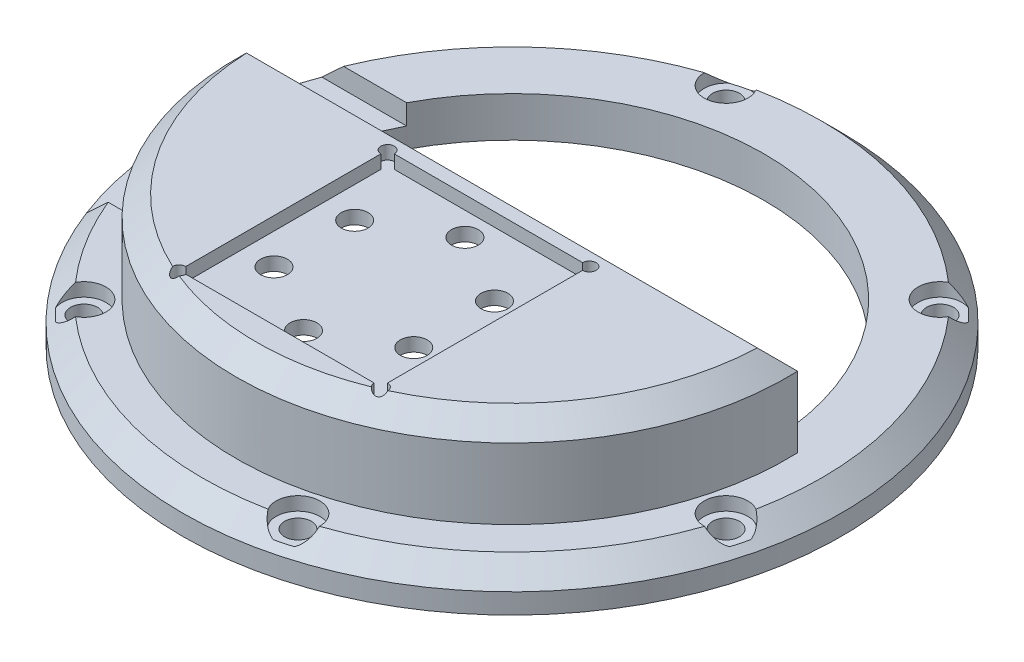
from build123d import *

# Parameters (mm, degrees)
SKETCH_1_R           = 49
SKETCH_1_R_2         = 37.5
SKETCH_1_R_3         = 2
EXTRUDE_1_DEPTH      = 15.5
EXTRUDE_START        = 15.5
SKETCH_1_3_R         = 49
SKETCH_1_3_R_2       = 2
EXTRUDE_2_DEPTH      = 4
CUT_EXTRUDE_START    = -8
SKETCH_2_W           = 31.667504192
SKETCH_2_H           = 35
CUT_EXTRUDE_1_DEPTH  = 8.5
SKETCH_4_R           = 3.25
CUT_EXTRUDE_3_DEPTH  = 15.5
CUT_EXTRUDE_START_2  = -13.5
SKETCH_6_R           = 49
SKETCH_6_R_2         = 41
CUT_EXTRUDE_7_DEPTH  = 13.5
SKETCH_8_R           = 2
CUT_EXTRUDE_9_DEPTH  = 16.5
SKETCH_7_W           = 30
SKETCH_7_H           = 31
CUT_EXTRUDE_11_DEPTH = 2
SKETCH_10_R          = 1
CUT_EXTRUDE_13_DEPTH = 2
SKETCH_12_W          = 94.768438907
SKETCH_12_H          = 47.5
CUT_EXTRUDE_14_DEPTH = 13.5
CHAMFER_1_SIZE       = 3
CHAMFER_2_SIZE       = 3
CHAMFER_3_SIZE       = 3


with BuildPart() as part:
    # 스케치1 → 보스-돌출1 (new body)
    with BuildSketch(Plane(origin=(0, 0, 0), x_dir=(1, 0, 0), z_dir=(0, 1, 0))):
        with Locations(Location((0, 0, 0), (0, 0, 270))):
            Circle(SKETCH_1_R)
        with Locations(Location((0, 0, 0), (0, 0, 270))):
            Circle(SKETCH_1_R_2, mode=Mode.SUBTRACT)
        with Locations(Location((-43.466662183, 11.64685703, 0), (0, 0, 270))):
            Circle(SKETCH_1_R_3, mode=Mode.SUBTRACT)
        with Locations(Location((-11.64685703, 43.466662183, 0), (0, 0, 270))):
            Circle(SKETCH_1_R_3, mode=Mode.SUBTRACT)
        with Locations(Location((31.819805153, 31.819805153, 0), (0, 0, 270))):
            Circle(SKETCH_1_R_3, mode=Mode.SUBTRACT)
        with Locations(Location((43.466662183, -11.64685703, 0), (0, 0, 270))):
            Circle(SKETCH_1_R_3, mode=Mode.SUBTRACT)
        with Locations(Location((11.64685703, -43.466662183, 0), (0, 0, 270))):
            Circle(SKETCH_1_R_3, mode=Mode.SUBTRACT)
        with Locations(Location((-31.819805153, -31.819805153, 0), (0, 0, 270))):
            Circle(SKETCH_1_R_3, mode=Mode.SUBTRACT)
    extrude(amount=EXTRUDE_1_DEPTH)

    # 스케치1<3> → 보스-돌출2 (add)
    with BuildSketch(Plane(origin=(0, 0, 0), x_dir=(1, 0, 0), z_dir=(0, 1, 0)).offset(EXTRUDE_START)):
        with Locations(Location((0, 0, 0), (0, 0, 270))):
            Circle(SKETCH_1_3_R)
        with Locations(Location((-43.466662183, 11.64685703, 0), (0, 0, 270))):
            Circle(SKETCH_1_3_R_2, mode=Mode.SUBTRACT)
        with Locations(Location((-11.64685703, 43.466662183, 0), (0, 0, 270))):
            Circle(SKETCH_1_3_R_2, mode=Mode.SUBTRACT)
        with Locations(Location((31.819805153, 31.819805153, 0), (0, 0, 270))):
            Circle(SKETCH_1_3_R_2, mode=Mode.SUBTRACT)
        with Locations(Location((43.466662183, -11.64685703, 0), (0, 0, 270))):
            Circle(SKETCH_1_3_R_2, mode=Mode.SUBTRACT)
        with Locations(Location((11.64685703, -43.466662183, 0), (0, 0, 270))):
            Circle(SKETCH_1_3_R_2, mode=Mode.SUBTRACT)
        with Locations(Location((-31.819805153, -31.819805153, 0), (0, 0, 270))):
            Circle(SKETCH_1_3_R_2, mode=Mode.SUBTRACT)
    extrude(amount=EXTRUDE_2_DEPTH)

    # 스케치2 → 컷-돌출1 (cut)
    with BuildSketch(Plane(origin=(0, 19.5, 0), x_dir=(1, 0, 0), z_dir=(0, 1, 0)).offset(CUT_EXTRUDE_START)):
        with Locations((-49, 0)):
            Rectangle(SKETCH_2_W, SKETCH_2_H)
    extrude(amount=-CUT_EXTRUDE_1_DEPTH, mode=Mode.SUBTRACT)

    # 스케치4 → 컷-돌출3 (cut)
    with BuildSketch(Plane(origin=(0, 19.5, 0), x_dir=(1, 0, 0), z_dir=(0, 1, 0))):
        with Locations(Location((-11.64685703, 43.466662183, 0), (0, 0, 270))):
            Circle(SKETCH_4_R)
        with Locations(Location((31.819805153, 31.819805153, 0), (0, 0, 270))):
            Circle(SKETCH_4_R)
        with Locations(Location((43.466662183, -11.64685703, 0), (0, 0, 270))):
            Circle(SKETCH_4_R)
        with Locations(Location((11.64685703, -43.466662183, 0), (0, 0, 270))):
            Circle(SKETCH_4_R)
        with Locations(Location((-31.819805153, -31.819805153, 0), (0, 0, 270))):
            Circle(SKETCH_4_R)
        with Locations(Location((-43.466662183, 11.64685703, 0), (0, 0, 270))):
            Circle(SKETCH_4_R)
    extrude(amount=-CUT_EXTRUDE_3_DEPTH, mode=Mode.SUBTRACT)

    # 스케치6 → 컷-돌출7 (cut)
    with BuildSketch(Plane(origin=(0, 19.5, 0), x_dir=(1, 0, 0), z_dir=(0, 1, 0)).offset(CUT_EXTRUDE_START_2)):
        with Locations(Location((0, 0, 0), (0, 0, 159.075167572))):
            Circle(SKETCH_6_R)
        with Locations(Location((0, 0, 0), (0, 0, 270))):
            Circle(SKETCH_6_R_2, mode=Mode.SUBTRACT)
    extrude(amount=CUT_EXTRUDE_7_DEPTH, mode=Mode.SUBTRACT)

    # 스케치8 → 컷-돌출9 (cut)
    with BuildSketch(Plane(origin=(0, 19.5, 0), x_dir=(1, 0, 0), z_dir=(0, 1, 0))):
        with Locations(Location((0, -7, 0), (0, 0, 270))):
            Circle(SKETCH_8_R)
        with Locations(Location((10.392304845, -13, 0), (0, 0, 270))):
            Circle(SKETCH_8_R)
        with Locations(Location((10.392304845, -25, 0), (0, 0, 270))):
            Circle(SKETCH_8_R)
        with Locations(Location((0, -31, 0), (0, 0, 270))):
            Circle(SKETCH_8_R)
        with Locations(Location((-10.392304845, -25, 0), (0, 0, 270))):
            Circle(SKETCH_8_R)
        with Locations(Location((-10.392304845, -13, 0), (0, 0, 270))):
            Circle(SKETCH_8_R)
    extrude(amount=-CUT_EXTRUDE_9_DEPTH, mode=Mode.SUBTRACT)

    # 스케치7 → 컷-돌출11 (cut)
    with BuildSketch(Plane(origin=(0, 19.5, 0), x_dir=(1, 0, 0), z_dir=(0, 1, 0))):
        with Locations((0, -19)):
            Rectangle(SKETCH_7_W, SKETCH_7_H)
    extrude(amount=-CUT_EXTRUDE_11_DEPTH, mode=Mode.SUBTRACT)

    # 스케치10 → 컷-돌출13 (cut)
    with BuildSketch(Plane(origin=(0, 19.5, 0), x_dir=(1, 0, 0), z_dir=(0, 1, 0))):
        with Locations((-15, -3.5)):
            Circle(SKETCH_10_R)
        with Locations((15, -3.5)):
            Circle(SKETCH_10_R)
        with Locations((15, -34.5)):
            Circle(SKETCH_10_R)
        with Locations((-15, -34.5)):
            Circle(SKETCH_10_R)
    extrude(amount=-CUT_EXTRUDE_13_DEPTH, mode=Mode.SUBTRACT)

    # 스케치12 → 컷-돌출14 (cut)
    with BuildSketch(Plane(origin=(0, 19.5, 0), x_dir=(1, 0, 0), z_dir=(0, 1, 0))):
        with Locations((1.615780546, 25.25)):
            Rectangle(SKETCH_12_W, SKETCH_12_H)
    extrude(amount=-CUT_EXTRUDE_14_DEPTH, mode=Mode.SUBTRACT)

    # 모따기1
    chamfer_1_edges = [part.edges().sort_by_distance(p)[0] for p in [
        (0, 19.5, -1.5),
    ]]
    chamfer(chamfer_1_edges, length=CHAMFER_1_SIZE)

    # 모따기2
    # the kernel refuses this chamfer: 3 mm, written as the material it takes off along each edge
    with BuildSketch(Plane(origin=(0, 6, 0), x_dir=(-0.978595972723543, 0, -0.20579096717121165), z_dir=(-0.20579096717121165, 0, 0.978595972723543))) as chamfer_2_piece_1:
        Polygon((49 - CHAMFER_2_SIZE, 0), (49, CHAMFER_2_SIZE), (49, 0), align=None)
    revolve(axis=Axis((0, 6, 0), (0, -1, 0)), revolution_arc=258.124194574, mode=Mode.SUBTRACT)
    with BuildSketch(Plane(origin=(0, 6, 0), x_dir=(-0.9785036629782533, 0, 0.20622943906760932), z_dir=(-0.20622943906760932, 0, -0.9785036629782533))) as chamfer_2_piece_2:
        Polygon((49 - CHAMFER_2_SIZE, 0), (49, -CHAMFER_2_SIZE), (49, 0), align=None)
    revolve(axis=Axis((0, 6, 0), (0, 1, 0)), revolution_arc=78.098521288, mode=Mode.SUBTRACT)

    # 모따기3
    # the kernel refuses this chamfer: 3 mm, written as the material it takes off along each edge
    with BuildSketch(Plane(origin=(0, 19.5, 0), x_dir=(0.9884903448479317, 0, -0.15128396525216095), z_dir=(-0.15128396525216095, 0, -0.9884903448479317))) as chamfer_3_piece_1:
        Polygon((41, CHAMFER_3_SIZE), (41 - CHAMFER_3_SIZE, 0), (41, 0), align=None)
    revolve(axis=Axis((0, 19.5, 0), (0, -1, 0)), revolution_arc=197.402683099, mode=Mode.SUBTRACT)


solid = part.part
